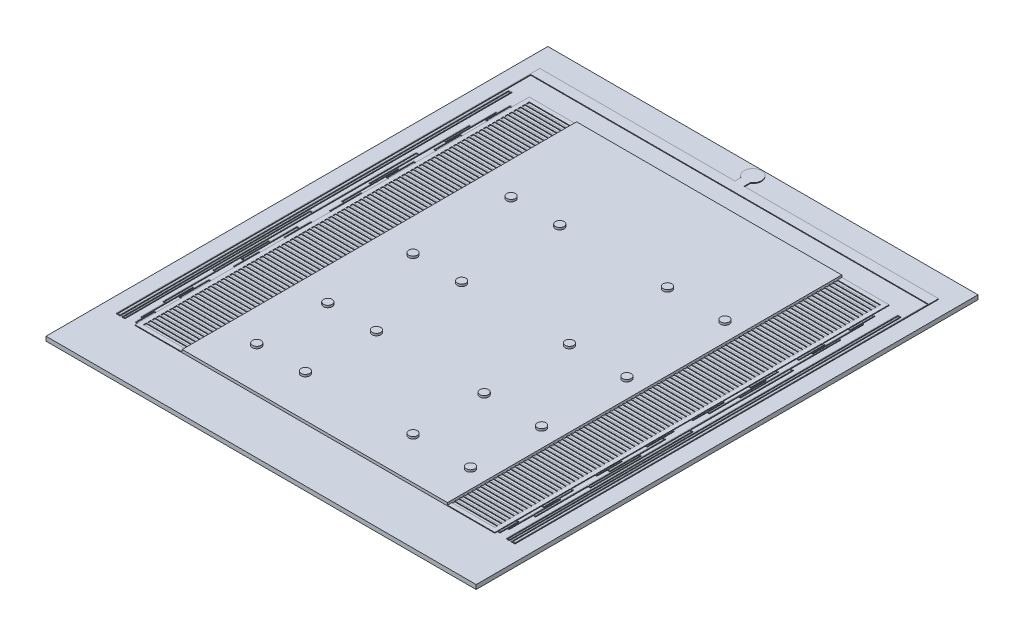
from build123d import *

# Parameters (mm, degrees)
SKETCH3_W               = 30
SKETCH3_H               = 35
BOSS_EXTRUDE2_DEPTH     = 0.3
SKETCH4_W               = 18.5
SKETCH4_H               = 27.5
BOSS_EXTRUDE5_DEPTH     = 0.2
SKETCH6_W               = 0.117783867
SKETCH6_H               = 1.603769596
SKETCH6_H_2             = 1.721308545
SKETCH6_H_3             = 1.817675336
SKETCH6_W_2             = 0.067378181
SKETCH6_H_4             = 2.081358624
SKETCH6_H_5             = 1.774483983
SKETCH6_H_6             = 1.660070327
SKETCH6_H_7             = 1.980065268
SKETCH6_H_8             = 1.224341961
BOSS_EXTRUDE10_DEPTH    = 0.05
SKETCH7_W               = 3
SKETCH7_H               = 0.2
CUT_EXTRUDE2_DEPTH      = 0.1
SKETCH8_R               = 0.3
BOSS_EXTRUDE11_DEPTH    = 0.15
BOSS_EXTRUDE11_2_DEPTH  = 0.15
BOSS_EXTRUDE11_3_DEPTH  = 0.15
BOSS_EXTRUDE11_4_DEPTH  = 0.15
BOSS_EXTRUDE11_5_DEPTH  = 0.15
BOSS_EXTRUDE11_6_DEPTH  = 0.15
BOSS_EXTRUDE11_7_DEPTH  = 0.15
BOSS_EXTRUDE11_8_DEPTH  = 0.15
BOSS_EXTRUDE11_9_DEPTH  = 0.15
BOSS_EXTRUDE11_10_DEPTH = 0.15
BOSS_EXTRUDE11_11_DEPTH = 0.15
BOSS_EXTRUDE11_12_DEPTH = 0.15
BOSS_EXTRUDE11_13_DEPTH = 0.15
BOSS_EXTRUDE11_14_DEPTH = 0.15
BOSS_EXTRUDE11_15_DEPTH = 0.15
BOSS_EXTRUDE11_16_DEPTH = 0.15


with BuildPart() as part:
    # Sketch3 → Boss-Extrude2 (new body)
    with BuildSketch(Plane(origin=(0, 0, 0), x_dir=(1, 0, 0), z_dir=(0, 1, 0))):
        Rectangle(SKETCH3_W, SKETCH3_H)
    extrude(amount=BOSS_EXTRUDE2_DEPTH)



with BuildPart() as body_2:
    # Sketch4 → Boss-Extrude5 (new body)
    with BuildSketch(Plane(origin=(0, 0.3, 0), x_dir=(1, 0, 0), z_dir=(0, 1, 0))):
        Rectangle(SKETCH4_W, SKETCH4_H)
    extrude(amount=BOSS_EXTRUDE5_DEPTH)


with BuildPart() as part_1:
    add(part.part)

    add(body_2.part)  # Boss-Extrude10 merges body 2
    # Sketch6 → Boss-Extrude10 (add)
    with BuildSketch(Plane(origin=(0, 0.3, 0), x_dir=(1, 0, 0), z_dir=(0, 1, 0))):
        with BuildLine():
            Line((-0.296809866, 15.847390228), (-13.905, 15.847390228))
            Line((-13.905, 15.847390228), (-13.905, -13.694209009))
            Line((-13.905, -13.694209009), (-13.635923322, -13.694209009))
            Line((-13.635923322, -13.694209009), (-13.635923322, 13.393625624))
            Line((-13.635923322, 13.393625624), (-13.511048423, 13.393625624))
            Line((-13.511048423, 13.393625624), (-13.511048423, -13.695971627))
            Line((-13.511048423, -13.695971627), (-13.29962544, -13.695971627))
            Line((-13.29962544, -13.695971627), (-13.29962544, -0.77669933))
            Line((-13.29962544, -0.77669933), (-13.154335568, -0.77669933))
            Line((-13.154335568, -0.77669933), (-13.154335568, -7.686248839))
            Line((-13.154335568, -7.686248839), (-12.996662195, -7.686248839))
            Line((-12.996662195, -7.686248839), (-12.996662195, -11.352681055))
            Line((-12.996662195, -11.352681055), (-12.829293014, -11.352681055))
            Line((-12.829293014, -11.352681055), (-12.829293014, -13.03981721))
            Line((-12.829293014, -13.03981721), (-12.717783867, -13.03981721))
            Line((-12.717783867, -13.03981721), (-12.717783867, -13.557084166))
            Line((-12.717783867, -13.557084166), (-12.55, -13.557084166))
            Line((-12.55, -13.557084166), (-12.55, -13.75))
            Line((-12.55, -13.75), (-9.25, -13.75))
            Line((-9.25, -13.75), (-9.25, 13.75))
            Line((-9.25, 13.75), (-12.55, 13.75))
            Line((-12.55, 13.75), (-12.55, 12.581818208))
            Line((-12.55, 12.581818208), (-12.717783867, 12.581818208))
            Line((-12.717783867, 12.581818208), (-12.717783867, 11.702139278))
            Line((-12.717783867, 11.702139278), (-12.819292054, 11.702139278))
            Line((-12.819292054, 11.702139278), (-12.819292054, 9.973586997))
            Line((-12.819292054, 9.973586997), (-12.953432268, 9.973586997))
            Line((-12.953432268, 9.973586997), (-12.953432268, 6.471730618))
            Line((-12.953432268, 6.471730618), (-13.154335568, 6.471730618))
            Line((-13.154335568, 6.471730618), (-13.154335568, -0.72669933))
            Line((-13.154335568, -0.72669933), (-13.34962544, -0.72669933))
            Line((-13.34962544, -0.72669933), (-13.34962544, -13.645971627))
            Line((-13.34962544, -13.645971627), (-13.461048423, -13.645971627))
            Line((-13.461048423, -13.645971627), (-13.461048423, 13.443625624))
            Line((-13.461048423, 13.443625624), (-13.685923322, 13.443625624))
            Line((-13.685923322, 13.443625624), (-13.685923322, -13.644209009))
            Line((-13.685923322, -13.644209009), (-13.855, -13.644209009))
            Line((-13.855, -13.644209009), (-13.855, 15.162745559))
            Line((-13.855, 15.162745559), (13.855, 15.162745559))
            Line((13.855, 15.162745559), (13.855, -13.644209009))
            Line((13.855, -13.644209009), (13.685923322, -13.644209009))
            Line((13.685923322, -13.644209009), (13.685923322, 13.443625624))
            Line((13.685923322, 13.443625624), (13.461048423, 13.443625624))
            Line((13.461048423, 13.443625624), (13.461048423, -13.645971627))
            Line((13.461048423, -13.645971627), (13.34962544, -13.645971627))
            Line((13.34962544, -13.645971627), (13.34962544, -0.72669933))
            Line((13.34962544, -0.72669933), (13.154335568, -0.72669933))
            Line((13.154335568, -0.72669933), (13.154335568, 6.471730618))
            Line((13.154335568, 6.471730618), (12.953432268, 6.471730618))
            Line((12.953432268, 6.471730618), (12.953432268, 9.973586997))
            Line((12.953432268, 9.973586997), (12.819292054, 9.973586997))
            Line((12.819292054, 9.973586997), (12.819292054, 11.702139278))
            Line((12.819292054, 11.702139278), (12.717783867, 11.702139278))
            Line((12.717783867, 11.702139278), (12.717783867, 12.581818208))
            Line((12.717783867, 12.581818208), (12.55, 12.581818208))
            Line((12.55, 12.581818208), (12.55, 13.75))
            Line((12.55, 13.75), (9.25, 13.75))
            Line((9.25, 13.75), (9.25, -13.75))
            Line((9.25, -13.75), (12.55, -13.75))
            Line((12.55, -13.75), (12.55, -13.557084166))
            Line((12.55, -13.557084166), (12.717783867, -13.557084166))
            Line((12.717783867, -13.557084166), (12.717783867, -13.03981721))
            Line((12.717783867, -13.03981721), (12.829293014, -13.03981721))
            Line((12.829293014, -13.03981721), (12.829293014, -11.352681055))
            Line((12.829293014, -11.352681055), (12.996662195, -11.352681055))
            Line((12.996662195, -11.352681055), (12.996662195, -7.686248839))
            Line((12.996662195, -7.686248839), (13.154335568, -7.686248839))
            Line((13.154335568, -7.686248839), (13.154335568, -0.77669933))
            Line((13.154335568, -0.77669933), (13.29962544, -0.77669933))
            Line((13.29962544, -0.77669933), (13.29962544, -13.695971627))
            Line((13.29962544, -13.695971627), (13.511048423, -13.695971627))
            Line((13.511048423, -13.695971627), (13.511048423, 13.393625624))
            Line((13.511048423, 13.393625624), (13.635923322, 13.393625624))
            Line((13.635923322, 13.393625624), (13.635923322, -13.694209009))
            Line((13.635923322, -13.694209009), (13.905, -13.694209009))
            Line((13.905, -13.694209009), (13.905, 15.847390228))
            Line((13.905, 15.847390228), (0.33596793, 15.847390228))
            Line((0.33596793, 15.847390228), (0.33596793, 16.289908331))
            ThreePointArc((0.33596793, 16.289908331), (-0.022955128, 17.400932864), (-0.296809866, 16.265941738))
            Line((-0.296809866, 16.265941738), (-0.296809866, 15.847390228))
        make_face()
        with Locations((-12.608891934, 11.72993341)):
            Rectangle(SKETCH6_W, SKETCH6_H, mode=Mode.SUBTRACT)
        Polygon((-12.717783867, 10.878048612), (-12.55, 10.878048612), (-12.55, 9.112513729), (-12.717783867, 9.112513729), (-12.717783867, 8.207460352), (-12.769292054, 8.207460352), (-12.769292054, 11.652139278), (-12.717783867, 11.652139278), align=None, mode=Mode.SUBTRACT)
        with Locations((-12.608891934, 8.201859457)):
            Rectangle(SKETCH6_W, SKETCH6_H_2, mode=Mode.SUBTRACT)
        Polygon((-12.717783867, 7.291205184), (-12.55, 7.291205184), (-12.55, 5.863231856), (-12.717783867, 5.863231856), (-12.717783867, 4.872175714), (-12.827409857, 4.872175714), (-12.827409857, 3.034439681), (-12.903432268, 3.034439681), (-12.903432268, 9.923586997), (-12.819292054, 9.923586997), (-12.819292054, 8.157460352), (-12.717783867, 8.157460352), align=None, mode=Mode.SUBTRACT)
        with Locations((-12.608891934, 4.904394188)):
            Rectangle(SKETCH6_W, SKETCH6_H_3, mode=Mode.SUBTRACT)
        Polygon((-12.717783867, 3.94555652), (-12.55, 3.94555652), (-12.55, 2.131358624), (-12.667378181, 2.131358624), (-12.667378181, 0.989514943), (-12.777409857, 0.989514943), (-12.777409857, 4.822175714), (-12.717783867, 4.822175714), align=None, mode=Mode.SUBTRACT)
        with Locations((-12.583689091, 1.040679312)):
            Rectangle(SKETCH6_W_2, SKETCH6_H_4, mode=Mode.SUBTRACT)
        Polygon((-12.667378181, -0.05), (-12.55, -0.05), (-12.55, -1.362951225), (-12.667378181, -1.362951225), (-12.667378181, -2.137736179), (-12.855127872, -2.137736179), (-12.855127872, -3.988239391), (-12.996662195, -3.988239391), (-12.996662195, -7.636248839), (-13.104335568, -7.636248839), (-13.104335568, 6.421730618), (-12.953432268, 6.421730618), (-12.953432268, 2.984439681), (-12.827409857, 2.984439681), (-12.827409857, 0.939514943), (-12.667378181, 0.939514943), align=None, mode=Mode.SUBTRACT)
        with Locations((-12.583689091, -2.300193217)):
            Rectangle(SKETCH6_W_2, SKETCH6_H_5, mode=Mode.SUBTRACT)
        Polygon((-12.667378181, -3.237435208), (-12.55, -3.237435208), (-12.55, -4.988354149), (-12.667378181, -4.988354149), (-12.667378181, -5.98071835), (-12.805127872, -5.98071835), (-12.805127872, -2.187736179), (-12.667378181, -2.187736179), align=None, mode=Mode.SUBTRACT)
        with Locations((-12.583689091, -5.868389312)):
            Rectangle(SKETCH6_W_2, SKETCH6_H_6, mode=Mode.SUBTRACT)
        Polygon((-12.667378181, -6.748424476), (-12.55, -6.748424476), (-12.55, -8.421954299), (-12.717783867, -8.421954299), (-12.717783867, -9.437671871), (-12.829293014, -9.437671871), (-12.829293014, -11.302681055), (-12.946662195, -11.302681055), (-12.946662195, -4.038239391), (-12.855127872, -4.038239391), (-12.855127872, -6.03071835), (-12.667378181, -6.03071835), align=None, mode=Mode.SUBTRACT)
        with Locations((-12.608891934, -9.461986933)):
            Rectangle(SKETCH6_W, SKETCH6_H_7, mode=Mode.SUBTRACT)
        Polygon((-12.717783867, -10.502019567), (-12.55, -10.502019567), (-12.55, -12.232742205), (-12.717783867, -12.232742205), (-12.717783867, -12.98981721), (-12.779293014, -12.98981721), (-12.779293014, -9.487671871), (-12.717783867, -9.487671871), align=None, mode=Mode.SUBTRACT)
        with Locations((-12.608891934, -12.894913186)):
            Rectangle(SKETCH6_W, SKETCH6_H_8, mode=Mode.SUBTRACT)
        with Locations((12.608891934, -12.894913186)):
            Rectangle(SKETCH6_W, SKETCH6_H_8, mode=Mode.SUBTRACT)
        Polygon((12.717783867, -12.232742205), (12.55, -12.232742205), (12.55, -10.502019567), (12.717783867, -10.502019567), (12.717783867, -9.487671871), (12.779293014, -9.487671871), (12.779293014, -12.98981721), (12.717783867, -12.98981721), align=None, mode=Mode.SUBTRACT)
        with Locations((12.608891934, -9.461986933)):
            Rectangle(SKETCH6_W, SKETCH6_H_7, mode=Mode.SUBTRACT)
        Polygon((12.717783867, -8.421954299), (12.55, -8.421954299), (12.55, -6.748424476), (12.667378181, -6.748424476), (12.667378181, -6.03071835), (12.855127872, -6.03071835), (12.855127872, -4.038239391), (12.946662195, -4.038239391), (12.946662195, -11.302681055), (12.829293014, -11.302681055), (12.829293014, -9.437671871), (12.717783867, -9.437671871), align=None, mode=Mode.SUBTRACT)
        with Locations((12.583689091, -5.868389312)):
            Rectangle(SKETCH6_W_2, SKETCH6_H_6, mode=Mode.SUBTRACT)
        Polygon((12.667378181, -4.988354149), (12.55, -4.988354149), (12.55, -3.237435208), (12.667378181, -3.237435208), (12.667378181, -2.187736179), (12.805127872, -2.187736179), (12.805127872, -5.98071835), (12.667378181, -5.98071835), align=None, mode=Mode.SUBTRACT)
        with Locations((12.583689091, -2.300193217)):
            Rectangle(SKETCH6_W_2, SKETCH6_H_5, mode=Mode.SUBTRACT)
        Polygon((12.667378181, -1.362951225), (12.55, -1.362951225), (12.55, -0.05), (12.667378181, -0.05), (12.667378181, 0.939514943), (12.827409857, 0.939514943), (12.827409857, 2.984439681), (12.953432268, 2.984439681), (12.953432268, 6.421730618), (13.104335568, 6.421730618), (13.104335568, -7.636248839), (12.996662195, -7.636248839), (12.996662195, -3.988239391), (12.855127872, -3.988239391), (12.855127872, -2.137736179), (12.667378181, -2.137736179), align=None, mode=Mode.SUBTRACT)
        with Locations((12.583689091, 1.040679312)):
            Rectangle(SKETCH6_W_2, SKETCH6_H_4, mode=Mode.SUBTRACT)
        Polygon((12.667378181, 2.131358624), (12.55, 2.131358624), (12.55, 3.94555652), (12.717783867, 3.94555652), (12.717783867, 4.822175714), (12.777409857, 4.822175714), (12.777409857, 0.989514943), (12.667378181, 0.989514943), align=None, mode=Mode.SUBTRACT)
        with Locations((12.608891934, 4.904394188)):
            Rectangle(SKETCH6_W, SKETCH6_H_3, mode=Mode.SUBTRACT)
        Polygon((12.717783867, 5.863231856), (12.55, 5.863231856), (12.55, 7.291205184), (12.717783867, 7.291205184), (12.717783867, 8.157460352), (12.819292054, 8.157460352), (12.819292054, 9.923586997), (12.903432268, 9.923586997), (12.903432268, 3.034439681), (12.827409857, 3.034439681), (12.827409857, 4.872175714), (12.717783867, 4.872175714), align=None, mode=Mode.SUBTRACT)
        with Locations((12.608891934, 8.201859457)):
            Rectangle(SKETCH6_W, SKETCH6_H_2, mode=Mode.SUBTRACT)
        Polygon((12.717783867, 9.112513729), (12.55, 9.112513729), (12.55, 10.878048612), (12.717783867, 10.878048612), (12.717783867, 11.652139278), (12.769292054, 11.652139278), (12.769292054, 8.207460352), (12.717783867, 8.207460352), align=None, mode=Mode.SUBTRACT)
        with Locations((12.608891934, 11.72993341)):
            Rectangle(SKETCH6_W, SKETCH6_H, mode=Mode.SUBTRACT)
    extrude(amount=BOSS_EXTRUDE10_DEPTH)

    # Sketch7 → Cut-Extrude2 (cut)
    with BuildSketch(Plane(origin=(0, 0.3, 0), x_dir=(1, 0, 0), z_dir=(0, 1, 0))):
        with Locations((10.75, 13.35)):
            Rectangle(SKETCH7_W, SKETCH7_H)
        with Locations((10.75, 13.05)):
            Rectangle(SKETCH7_W, SKETCH7_H)
        with Locations((10.75, 12.75)):
            Rectangle(SKETCH7_W, SKETCH7_H)
        with Locations((10.75, 12.45)):
            Rectangle(SKETCH7_W, SKETCH7_H)
        with Locations((10.75, 12.15)):
            Rectangle(SKETCH7_W, SKETCH7_H)
        with Locations((10.75, 11.85)):
            Rectangle(SKETCH7_W, SKETCH7_H)
        with Locations((10.75, 11.55)):
            Rectangle(SKETCH7_W, SKETCH7_H)
        with Locations((10.75, 11.25)):
            Rectangle(SKETCH7_W, SKETCH7_H)
        with Locations((10.75, 10.95)):
            Rectangle(SKETCH7_W, SKETCH7_H)
        with Locations((10.75, 10.65)):
            Rectangle(SKETCH7_W, SKETCH7_H)
        with Locations((10.75, 10.35)):
            Rectangle(SKETCH7_W, SKETCH7_H)
        with Locations((10.75, 10.05)):
            Rectangle(SKETCH7_W, SKETCH7_H)
        with Locations((10.75, 9.75)):
            Rectangle(SKETCH7_W, SKETCH7_H)
        with Locations((10.75, 9.45)):
            Rectangle(SKETCH7_W, SKETCH7_H)
        with Locations((10.75, 9.15)):
            Rectangle(SKETCH7_W, SKETCH7_H)
        with Locations((10.75, 8.85)):
            Rectangle(SKETCH7_W, SKETCH7_H)
        with Locations((10.75, 8.55)):
            Rectangle(SKETCH7_W, SKETCH7_H)
        with Locations((10.75, 8.25)):
            Rectangle(SKETCH7_W, SKETCH7_H)
        with Locations((10.75, 7.95)):
            Rectangle(SKETCH7_W, SKETCH7_H)
        with Locations((10.75, 7.65)):
            Rectangle(SKETCH7_W, SKETCH7_H)
        with Locations((10.75, 7.35)):
            Rectangle(SKETCH7_W, SKETCH7_H)
        with Locations((10.75, 7.05)):
            Rectangle(SKETCH7_W, SKETCH7_H)
        with Locations((10.75, 6.75)):
            Rectangle(SKETCH7_W, SKETCH7_H)
        with Locations((10.75, 6.45)):
            Rectangle(SKETCH7_W, SKETCH7_H)
        with Locations((10.75, 6.15)):
            Rectangle(SKETCH7_W, SKETCH7_H)
        with Locations((10.75, 5.85)):
            Rectangle(SKETCH7_W, SKETCH7_H)
        with Locations((10.75, 5.55)):
            Rectangle(SKETCH7_W, SKETCH7_H)
        with Locations((10.75, 5.25)):
            Rectangle(SKETCH7_W, SKETCH7_H)
        with Locations((10.75, 4.95)):
            Rectangle(SKETCH7_W, SKETCH7_H)
        with Locations((10.75, 4.65)):
            Rectangle(SKETCH7_W, SKETCH7_H)
        with Locations((10.75, 4.35)):
            Rectangle(SKETCH7_W, SKETCH7_H)
        with Locations((10.75, 4.05)):
            Rectangle(SKETCH7_W, SKETCH7_H)
        with Locations((10.75, 3.75)):
            Rectangle(SKETCH7_W, SKETCH7_H)
        with Locations((10.75, 3.45)):
            Rectangle(SKETCH7_W, SKETCH7_H)
        with Locations((10.75, 3.15)):
            Rectangle(SKETCH7_W, SKETCH7_H)
        with Locations((10.75, 2.85)):
            Rectangle(SKETCH7_W, SKETCH7_H)
        with Locations((10.75, 2.55)):
            Rectangle(SKETCH7_W, SKETCH7_H)
        with Locations((10.75, 2.25)):
            Rectangle(SKETCH7_W, SKETCH7_H)
        with Locations((10.75, 1.95)):
            Rectangle(SKETCH7_W, SKETCH7_H)
        with Locations((10.75, 1.65)):
            Rectangle(SKETCH7_W, SKETCH7_H)
        with Locations((10.75, 1.35)):
            Rectangle(SKETCH7_W, SKETCH7_H)
        with Locations((10.75, 1.05)):
            Rectangle(SKETCH7_W, SKETCH7_H)
        with Locations((10.75, 0.75)):
            Rectangle(SKETCH7_W, SKETCH7_H)
        with Locations((10.75, 0.45)):
            Rectangle(SKETCH7_W, SKETCH7_H)
        with Locations((10.75, 0.15)):
            Rectangle(SKETCH7_W, SKETCH7_H)
        with Locations((10.75, -0.15)):
            Rectangle(SKETCH7_W, SKETCH7_H)
        with Locations((10.75, -0.45)):
            Rectangle(SKETCH7_W, SKETCH7_H)
        with Locations((10.75, -0.75)):
            Rectangle(SKETCH7_W, SKETCH7_H)
        with Locations((10.75, -1.05)):
            Rectangle(SKETCH7_W, SKETCH7_H)
        with Locations((10.75, -1.35)):
            Rectangle(SKETCH7_W, SKETCH7_H)
        with Locations((10.75, -1.65)):
            Rectangle(SKETCH7_W, SKETCH7_H)
        with Locations((10.75, -1.95)):
            Rectangle(SKETCH7_W, SKETCH7_H)
        with Locations((10.75, -2.25)):
            Rectangle(SKETCH7_W, SKETCH7_H)
        with Locations((10.75, -2.55)):
            Rectangle(SKETCH7_W, SKETCH7_H)
        with Locations((10.75, -2.85)):
            Rectangle(SKETCH7_W, SKETCH7_H)
        with Locations((10.75, -3.15)):
            Rectangle(SKETCH7_W, SKETCH7_H)
        with Locations((10.75, -3.45)):
            Rectangle(SKETCH7_W, SKETCH7_H)
        with Locations((10.75, -3.75)):
            Rectangle(SKETCH7_W, SKETCH7_H)
        with Locations((10.75, -4.05)):
            Rectangle(SKETCH7_W, SKETCH7_H)
        with Locations((10.75, -4.35)):
            Rectangle(SKETCH7_W, SKETCH7_H)
        with Locations((10.75, -4.65)):
            Rectangle(SKETCH7_W, SKETCH7_H)
        with Locations((10.75, -4.95)):
            Rectangle(SKETCH7_W, SKETCH7_H)
        with Locations((10.75, -5.25)):
            Rectangle(SKETCH7_W, SKETCH7_H)
        with Locations((10.75, -5.55)):
            Rectangle(SKETCH7_W, SKETCH7_H)
        with Locations((10.75, -5.85)):
            Rectangle(SKETCH7_W, SKETCH7_H)
        with Locations((10.75, -6.15)):
            Rectangle(SKETCH7_W, SKETCH7_H)
        with Locations((10.75, -6.45)):
            Rectangle(SKETCH7_W, SKETCH7_H)
        with Locations((10.75, -6.75)):
            Rectangle(SKETCH7_W, SKETCH7_H)
        with Locations((10.75, -7.05)):
            Rectangle(SKETCH7_W, SKETCH7_H)
        with Locations((10.75, -7.35)):
            Rectangle(SKETCH7_W, SKETCH7_H)
        with Locations((10.75, -7.65)):
            Rectangle(SKETCH7_W, SKETCH7_H)
        with Locations((10.75, -7.95)):
            Rectangle(SKETCH7_W, SKETCH7_H)
        with Locations((10.75, -8.25)):
            Rectangle(SKETCH7_W, SKETCH7_H)
        with Locations((10.75, -8.55)):
            Rectangle(SKETCH7_W, SKETCH7_H)
        with Locations((10.75, -8.85)):
            Rectangle(SKETCH7_W, SKETCH7_H)
        with Locations((10.75, -9.15)):
            Rectangle(SKETCH7_W, SKETCH7_H)
        with Locations((10.75, -9.45)):
            Rectangle(SKETCH7_W, SKETCH7_H)
        with Locations((10.75, -9.75)):
            Rectangle(SKETCH7_W, SKETCH7_H)
        with Locations((10.75, -10.05)):
            Rectangle(SKETCH7_W, SKETCH7_H)
        with Locations((10.75, -10.35)):
            Rectangle(SKETCH7_W, SKETCH7_H)
        with Locations((10.75, -10.65)):
            Rectangle(SKETCH7_W, SKETCH7_H)
        with Locations((10.75, -10.95)):
            Rectangle(SKETCH7_W, SKETCH7_H)
        with Locations((10.75, -11.25)):
            Rectangle(SKETCH7_W, SKETCH7_H)
        with Locations((10.75, -11.55)):
            Rectangle(SKETCH7_W, SKETCH7_H)
        with Locations((10.75, -11.85)):
            Rectangle(SKETCH7_W, SKETCH7_H)
        with Locations((10.75, -12.15)):
            Rectangle(SKETCH7_W, SKETCH7_H)
        with Locations((10.75, -12.45)):
            Rectangle(SKETCH7_W, SKETCH7_H)
        with Locations((10.75, -12.75)):
            Rectangle(SKETCH7_W, SKETCH7_H)
        with Locations((10.75, -13.05)):
            Rectangle(SKETCH7_W, SKETCH7_H)
        with Locations((10.75, -13.35)):
            Rectangle(SKETCH7_W, SKETCH7_H)
        with Locations((-10.75, 13.35)):
            Rectangle(SKETCH7_W, SKETCH7_H)
        with Locations((-10.75, 13.05)):
            Rectangle(SKETCH7_W, SKETCH7_H)
        with Locations((-10.75, 12.75)):
            Rectangle(SKETCH7_W, SKETCH7_H)
        with Locations((-10.75, 12.45)):
            Rectangle(SKETCH7_W, SKETCH7_H)
        with Locations((-10.75, 12.15)):
            Rectangle(SKETCH7_W, SKETCH7_H)
        with Locations((-10.75, 11.85)):
            Rectangle(SKETCH7_W, SKETCH7_H)
        with Locations((-10.75, 11.55)):
            Rectangle(SKETCH7_W, SKETCH7_H)
        with Locations((-10.75, 11.25)):
            Rectangle(SKETCH7_W, SKETCH7_H)
        with Locations((-10.75, 10.95)):
            Rectangle(SKETCH7_W, SKETCH7_H)
        with Locations((-10.75, 10.65)):
            Rectangle(SKETCH7_W, SKETCH7_H)
        with Locations((-10.75, 10.35)):
            Rectangle(SKETCH7_W, SKETCH7_H)
        with Locations((-10.75, 10.05)):
            Rectangle(SKETCH7_W, SKETCH7_H)
        with Locations((-10.75, 9.75)):
            Rectangle(SKETCH7_W, SKETCH7_H)
        with Locations((-10.75, 9.45)):
            Rectangle(SKETCH7_W, SKETCH7_H)
        with Locations((-10.75, 9.15)):
            Rectangle(SKETCH7_W, SKETCH7_H)
        with Locations((-10.75, 8.85)):
            Rectangle(SKETCH7_W, SKETCH7_H)
        with Locations((-10.75, 8.55)):
            Rectangle(SKETCH7_W, SKETCH7_H)
        with Locations((-10.75, 8.25)):
            Rectangle(SKETCH7_W, SKETCH7_H)
        with Locations((-10.75, 7.95)):
            Rectangle(SKETCH7_W, SKETCH7_H)
        with Locations((-10.75, 7.65)):
            Rectangle(SKETCH7_W, SKETCH7_H)
        with Locations((-10.75, 7.35)):
            Rectangle(SKETCH7_W, SKETCH7_H)
        with Locations((-10.75, 7.05)):
            Rectangle(SKETCH7_W, SKETCH7_H)
        with Locations((-10.75, 6.75)):
            Rectangle(SKETCH7_W, SKETCH7_H)
        with Locations((-10.75, 6.45)):
            Rectangle(SKETCH7_W, SKETCH7_H)
        with Locations((-10.75, 6.15)):
            Rectangle(SKETCH7_W, SKETCH7_H)
        with Locations((-10.75, 5.85)):
            Rectangle(SKETCH7_W, SKETCH7_H)
        with Locations((-10.75, 5.55)):
            Rectangle(SKETCH7_W, SKETCH7_H)
        with Locations((-10.75, 5.25)):
            Rectangle(SKETCH7_W, SKETCH7_H)
        with Locations((-10.75, 4.95)):
            Rectangle(SKETCH7_W, SKETCH7_H)
        with Locations((-10.75, 4.65)):
            Rectangle(SKETCH7_W, SKETCH7_H)
        with Locations((-10.75, 4.35)):
            Rectangle(SKETCH7_W, SKETCH7_H)
        with Locations((-10.75, 4.05)):
            Rectangle(SKETCH7_W, SKETCH7_H)
        with Locations((-10.75, 3.75)):
            Rectangle(SKETCH7_W, SKETCH7_H)
        with Locations((-10.75, 3.45)):
            Rectangle(SKETCH7_W, SKETCH7_H)
        with Locations((-10.75, 3.15)):
            Rectangle(SKETCH7_W, SKETCH7_H)
        with Locations((-10.75, 2.85)):
            Rectangle(SKETCH7_W, SKETCH7_H)
        with Locations((-10.75, 2.55)):
            Rectangle(SKETCH7_W, SKETCH7_H)
        with Locations((-10.75, 2.25)):
            Rectangle(SKETCH7_W, SKETCH7_H)
        with Locations((-10.75, 1.95)):
            Rectangle(SKETCH7_W, SKETCH7_H)
        with Locations((-10.75, 1.65)):
            Rectangle(SKETCH7_W, SKETCH7_H)
        with Locations((-10.75, 1.35)):
            Rectangle(SKETCH7_W, SKETCH7_H)
        with Locations((-10.75, 1.05)):
            Rectangle(SKETCH7_W, SKETCH7_H)
        with Locations((-10.75, 0.75)):
            Rectangle(SKETCH7_W, SKETCH7_H)
        with Locations((-10.75, 0.45)):
            Rectangle(SKETCH7_W, SKETCH7_H)
        with Locations((-10.75, 0.15)):
            Rectangle(SKETCH7_W, SKETCH7_H)
        with Locations((-10.75, -0.15)):
            Rectangle(SKETCH7_W, SKETCH7_H)
        with Locations((-10.75, -0.45)):
            Rectangle(SKETCH7_W, SKETCH7_H)
        with Locations((-10.75, -0.75)):
            Rectangle(SKETCH7_W, SKETCH7_H)
        with Locations((-10.75, -1.05)):
            Rectangle(SKETCH7_W, SKETCH7_H)
        with Locations((-10.75, -1.35)):
            Rectangle(SKETCH7_W, SKETCH7_H)
        with Locations((-10.75, -1.65)):
            Rectangle(SKETCH7_W, SKETCH7_H)
        with Locations((-10.75, -1.95)):
            Rectangle(SKETCH7_W, SKETCH7_H)
        with Locations((-10.75, -2.25)):
            Rectangle(SKETCH7_W, SKETCH7_H)
        with Locations((-10.75, -2.55)):
            Rectangle(SKETCH7_W, SKETCH7_H)
        with Locations((-10.75, -2.85)):
            Rectangle(SKETCH7_W, SKETCH7_H)
        with Locations((-10.75, -3.15)):
            Rectangle(SKETCH7_W, SKETCH7_H)
        with Locations((-10.75, -3.45)):
            Rectangle(SKETCH7_W, SKETCH7_H)
        with Locations((-10.75, -3.75)):
            Rectangle(SKETCH7_W, SKETCH7_H)
        with Locations((-10.75, -4.05)):
            Rectangle(SKETCH7_W, SKETCH7_H)
        with Locations((-10.75, -4.35)):
            Rectangle(SKETCH7_W, SKETCH7_H)
        with Locations((-10.75, -4.65)):
            Rectangle(SKETCH7_W, SKETCH7_H)
        with Locations((-10.75, -4.95)):
            Rectangle(SKETCH7_W, SKETCH7_H)
        with Locations((-10.75, -5.25)):
            Rectangle(SKETCH7_W, SKETCH7_H)
        with Locations((-10.75, -5.55)):
            Rectangle(SKETCH7_W, SKETCH7_H)
        with Locations((-10.75, -5.85)):
            Rectangle(SKETCH7_W, SKETCH7_H)
        with Locations((-10.75, -6.15)):
            Rectangle(SKETCH7_W, SKETCH7_H)
        with Locations((-10.75, -6.45)):
            Rectangle(SKETCH7_W, SKETCH7_H)
        with Locations((-10.75, -6.75)):
            Rectangle(SKETCH7_W, SKETCH7_H)
        with Locations((-10.75, -7.05)):
            Rectangle(SKETCH7_W, SKETCH7_H)
        with Locations((-10.75, -7.35)):
            Rectangle(SKETCH7_W, SKETCH7_H)
        with Locations((-10.75, -7.65)):
            Rectangle(SKETCH7_W, SKETCH7_H)
        with Locations((-10.75, -7.95)):
            Rectangle(SKETCH7_W, SKETCH7_H)
        with Locations((-10.75, -8.25)):
            Rectangle(SKETCH7_W, SKETCH7_H)
        with Locations((-10.75, -8.55)):
            Rectangle(SKETCH7_W, SKETCH7_H)
        with Locations((-10.75, -8.85)):
            Rectangle(SKETCH7_W, SKETCH7_H)
        with Locations((-10.75, -9.15)):
            Rectangle(SKETCH7_W, SKETCH7_H)
        with Locations((-10.75, -9.45)):
            Rectangle(SKETCH7_W, SKETCH7_H)
        with Locations((-10.75, -9.75)):
            Rectangle(SKETCH7_W, SKETCH7_H)
        with Locations((-10.75, -10.05)):
            Rectangle(SKETCH7_W, SKETCH7_H)
        with Locations((-10.75, -10.35)):
            Rectangle(SKETCH7_W, SKETCH7_H)
        with Locations((-10.75, -10.65)):
            Rectangle(SKETCH7_W, SKETCH7_H)
        with Locations((-10.75, -10.95)):
            Rectangle(SKETCH7_W, SKETCH7_H)
        with Locations((-10.75, -11.25)):
            Rectangle(SKETCH7_W, SKETCH7_H)
        with Locations((-10.75, -11.55)):
            Rectangle(SKETCH7_W, SKETCH7_H)
        with Locations((-10.75, -11.85)):
            Rectangle(SKETCH7_W, SKETCH7_H)
        with Locations((-10.75, -12.15)):
            Rectangle(SKETCH7_W, SKETCH7_H)
        with Locations((-10.75, -12.45)):
            Rectangle(SKETCH7_W, SKETCH7_H)
        with Locations((-10.75, -12.75)):
            Rectangle(SKETCH7_W, SKETCH7_H)
        with Locations((-10.75, -13.05)):
            Rectangle(SKETCH7_W, SKETCH7_H)
        with Locations((-10.75, -13.35)):
            Rectangle(SKETCH7_W, SKETCH7_H)
    extrude(amount=CUT_EXTRUDE2_DEPTH, mode=Mode.SUBTRACT)


with BuildPart() as body_2_2:
    # Sketch8 → Boss-Extrude11 (new body)
    with BuildSketch(Plane(origin=(0, 0.5, 0), x_dir=(1, 0, 0), z_dir=(0, 1, 0))):
        with Locations((4.004629842, 6.842196131)):
            Circle(SKETCH8_R)
    extrude(amount=BOSS_EXTRUDE11_DEPTH)


with BuildPart() as body_3:
    # Sketch8 → Boss-Extrude11 2 (new body)
    with BuildSketch(Plane(origin=(0, 0.5, 0), x_dir=(1, 0, 0), z_dir=(0, 1, 0))):
        with Locations((8.009259685, 6.842196131)):
            Circle(SKETCH8_R)
    extrude(amount=BOSS_EXTRUDE11_2_DEPTH)


with BuildPart() as body_4:
    # Sketch8 → Boss-Extrude11 3 (new body)
    with BuildSketch(Plane(origin=(0, 0.5, 0), x_dir=(1, 0, 0), z_dir=(0, 1, 0))):
        with Locations((4.004629842, 0)):
            Circle(SKETCH8_R)
    extrude(amount=BOSS_EXTRUDE11_3_DEPTH)


with BuildPart() as body_5:
    # Sketch8 → Boss-Extrude11 4 (new body)
    with BuildSketch(Plane(origin=(0, 0.5, 0), x_dir=(1, 0, 0), z_dir=(0, 1, 0))):
        with Locations((8.009259685, 0)):
            Circle(SKETCH8_R)
    extrude(amount=BOSS_EXTRUDE11_4_DEPTH)


with BuildPart() as body_6:
    # Sketch8 → Boss-Extrude11 5 (new body)
    with BuildSketch(Plane(origin=(0, 0.5, 0), x_dir=(1, 0, 0), z_dir=(0, 1, 0))):
        with Locations((4.004629842, -5.94491358)):
            Circle(SKETCH8_R)
    extrude(amount=BOSS_EXTRUDE11_5_DEPTH)


with BuildPart() as body_7:
    # Sketch8 → Boss-Extrude11 6 (new body)
    with BuildSketch(Plane(origin=(0, 0.5, 0), x_dir=(1, 0, 0), z_dir=(0, 1, 0))):
        with Locations((8.009259685, -5.94491358)):
            Circle(SKETCH8_R)
    extrude(amount=BOSS_EXTRUDE11_6_DEPTH)


with BuildPart() as body_8:
    # Sketch8 → Boss-Extrude11 7 (new body)
    with BuildSketch(Plane(origin=(0, 0.5, 0), x_dir=(1, 0, 0), z_dir=(0, 1, 0))):
        with Locations((4.004629842, -10.899691356)):
            Circle(SKETCH8_R)
    extrude(amount=BOSS_EXTRUDE11_7_DEPTH)


with BuildPart() as body_9:
    # Sketch8 → Boss-Extrude11 8 (new body)
    with BuildSketch(Plane(origin=(0, 0.5, 0), x_dir=(1, 0, 0), z_dir=(0, 1, 0))):
        with Locations((8.009259685, -10.899691356)):
            Circle(SKETCH8_R)
    extrude(amount=BOSS_EXTRUDE11_8_DEPTH)


with BuildPart() as body_10:
    # Sketch8 → Boss-Extrude11 9 (new body)
    with BuildSketch(Plane(origin=(0, 0.5, 0), x_dir=(1, 0, 0), z_dir=(0, 1, 0))):
        with Locations((-3.510730261, -10.899691356)):
            Circle(SKETCH8_R)
    extrude(amount=BOSS_EXTRUDE11_9_DEPTH)


with BuildPart() as body_11:
    # Sketch8 → Boss-Extrude11 10 (new body)
    with BuildSketch(Plane(origin=(0, 0.5, 0), x_dir=(1, 0, 0), z_dir=(0, 1, 0))):
        with Locations((-6.90239362, -10.899691356)):
            Circle(SKETCH8_R)
    extrude(amount=BOSS_EXTRUDE11_10_DEPTH)


with BuildPart() as body_12:
    # Sketch8 → Boss-Extrude11 11 (new body)
    with BuildSketch(Plane(origin=(0, 0.5, 0), x_dir=(1, 0, 0), z_dir=(0, 1, 0))):
        with Locations((-6.90239362, -5.94491358)):
            Circle(SKETCH8_R)
    extrude(amount=BOSS_EXTRUDE11_11_DEPTH)


with BuildPart() as body_13:
    # Sketch8 → Boss-Extrude11 12 (new body)
    with BuildSketch(Plane(origin=(0, 0.5, 0), x_dir=(1, 0, 0), z_dir=(0, 1, 0))):
        with Locations((-3.510730261, -5.94491358)):
            Circle(SKETCH8_R)
    extrude(amount=BOSS_EXTRUDE11_12_DEPTH)


with BuildPart() as body_14:
    # Sketch8 → Boss-Extrude11 13 (new body)
    with BuildSketch(Plane(origin=(0, 0.5, 0), x_dir=(1, 0, 0), z_dir=(0, 1, 0))):
        with Locations((-3.510730261, 0)):
            Circle(SKETCH8_R)
    extrude(amount=BOSS_EXTRUDE11_13_DEPTH)


with BuildPart() as body_15:
    # Sketch8 → Boss-Extrude11 14 (new body)
    with BuildSketch(Plane(origin=(0, 0.5, 0), x_dir=(1, 0, 0), z_dir=(0, 1, 0))):
        with Locations((-6.90239362, 0)):
            Circle(SKETCH8_R)
    extrude(amount=BOSS_EXTRUDE11_14_DEPTH)


with BuildPart() as body_16:
    # Sketch8 → Boss-Extrude11 15 (new body)
    with BuildSketch(Plane(origin=(0, 0.5, 0), x_dir=(1, 0, 0), z_dir=(0, 1, 0))):
        with Locations((-6.90239362, 6.842196131)):
            Circle(SKETCH8_R)
    extrude(amount=BOSS_EXTRUDE11_15_DEPTH)


with BuildPart() as body_17:
    # Sketch8 → Boss-Extrude11 16 (new body)
    with BuildSketch(Plane(origin=(0, 0.5, 0), x_dir=(1, 0, 0), z_dir=(0, 1, 0))):
        with Locations((-3.510730261, 6.842196131)):
            Circle(SKETCH8_R)
    extrude(amount=BOSS_EXTRUDE11_16_DEPTH)


solid = Compound([part_1.part, body_2_2.part, body_3.part, body_4.part, body_5.part, body_6.part, body_7.part, body_8.part, body_9.part, body_10.part, body_11.part, body_12.part, body_13.part, body_14.part, body_15.part, body_16.part, body_17.part])
